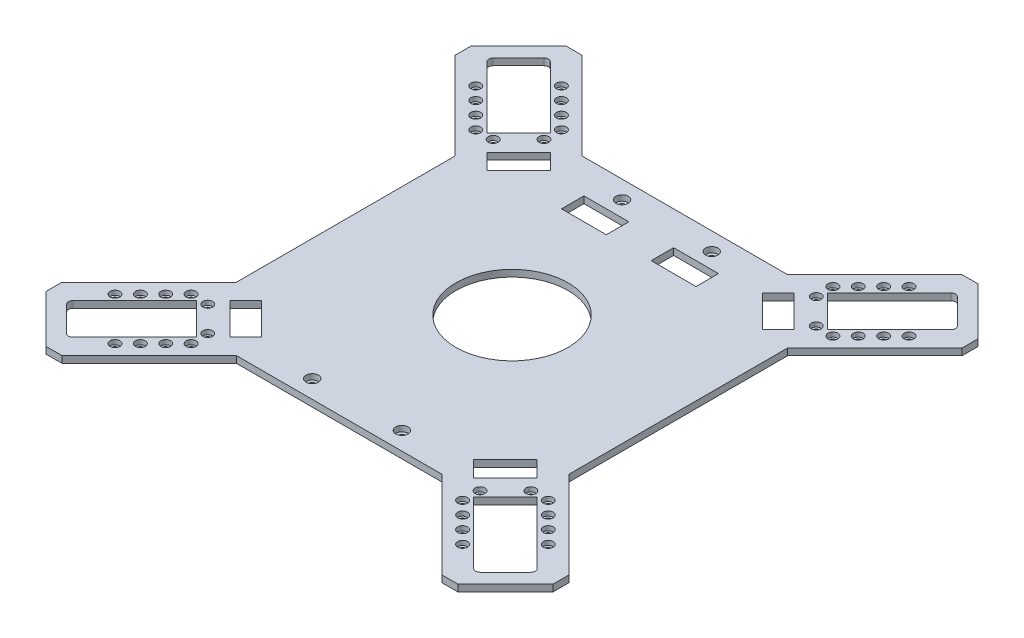
from build123d import *

# Parameters (mm, degrees)
BOSS_EXTRUDE1_DEPTH              = 3
CUT_EXTRUDE1_DEPTH               = 10
CUT_EXTRUDE2_DEPTH               = 10
CBORE_FOR_M2_SHCS1_D             = 2.4
CBORE_FOR_M2_SHCS1_CBORE_D       = 4.4
CBORE_FOR_M2_SHCS1_CBORE_DEPTH   = 2
MIRROR2_COPY_1_D                 = 2.4
MIRROR2_COPY_1_CBORE_D           = 4.4
MIRROR2_COPY_1_CBORE_DEPTH       = 2
SKETCH8_W                        = 20
SKETCH8_H                        = 10
SKETCH8_W_2                      = 60
CUT_EXTRUDE3_DEPTH               = 10
CBORE_FOR_M2_5_SHCS1_D           = 2.9
CBORE_FOR_M2_5_SHCS1_CBORE_D     = 5.5
CBORE_FOR_M2_5_SHCS1_CBORE_DEPTH = 2.5
CORTAR_EXTRUIR1_DEPTH            = 848
CORTAR_EXTRUIR1_DEPTH_BACK       = 962
CROQUIS1_W                       = 356.551899134
CROQUIS1_H                       = 194.800027737
CROQUIS3_W                       = 148.284271248
CROQUIS3_H                       = 70
SALIENTE_EXTRUIR3_DEPTH          = 3
SALIENTE_EXTRUIR4_DEPTH          = 3
CORTAR_EXTRUIR3_DEPTH            = 3
CROQUIS10_R                      = 1.2
CORTAR_EXTRUIR13_DEPTH           = 3
CROQUIS22_R                      = 2.2
CORTAR_EXTRUIR14_DEPTH           = 2
CORTAR_EXTRUIR16_DEPTH           = 243
CORTAR_EXTRUIR16_DEPTH_BACK      = 68
CROQUIS25_R                      = 1.2
CORTAR_EXTRUIR17_DEPTH           = 3
CROQUIS26_R                      = 1.2
CORTAR_EXTRUIR18_DEPTH           = 3
CROQUIS27_R                      = 2.2
CORTAR_EXTRUIR19_DEPTH           = 2
CROQUIS29_R                      = 1.2
CORTAR_EXTRUIR20_DEPTH           = 3
CROQUIS30_R                      = 2.2
CORTAR_EXTRUIR21_DEPTH           = 2
SALIENTE_EXTRUIR5_DEPTH          = 3
CORTAR_EXTRUIR22_DEPTH           = 3
CROQUIS34_R                      = 1.2
CORTAR_EXTRUIR24_DEPTH           = 3
CROQUIS35_R                      = 2.2
CORTAR_EXTRUIR25_DEPTH           = 2
CROQUIS37_R                      = 1.2
CORTAR_EXTRUIR26_DEPTH           = 3
CROQUIS38_R                      = 2.2
CORTAR_EXTRUIR27_DEPTH           = 2
CROQUIS39_R                      = 1.2
CORTAR_EXTRUIR28_DEPTH           = 3
CROQUIS40_R                      = 2.2
CORTAR_EXTRUIR30_DEPTH           = 2
CROQUIS47_R                      = 1.45
CORTAR_EXTRUIR32_DEPTH           = 3
CROQUIS48_R                      = 2.75
CORTAR_EXTRUIR33_DEPTH           = 2.5
RECUBRIR1_DEPTH                  = 3
RECUBRIR3_DEPTH                  = 3
CROQUIS50_R                      = 12
SALIENTE_EXTRUIR6_DEPTH          = 3
RECUBRIR6_DEPTH                  = 3
RECUBRIR7_DEPTH                  = 3
RECUBRIR8_DEPTH                  = 3
RECUBRIR9_DEPTH                  = 3
RECUBRIR10_DEPTH                 = 3
RECUBRIR13_DEPTH                 = 3
CROQUIS52_R                      = 12
SALIENTE_EXTRUIR8_DEPTH          = 3
CORTAR_EXTRUIR35_DEPTH           = 25
CORTAR_EXTRUIR35_DEPTH_BACK      = 16
CORTAR_EXTRUIR36_DEPTH           = 108
CORTAR_EXTRUIR36_DEPTH_BACK      = 71
CORTAR_EXTRUIR37_DEPTH           = 193
CORTAR_EXTRUIR37_DEPTH_BACK      = 197
CORTAR_EXTRUIR38_DEPTH           = 32
CORTAR_EXTRUIR38_DEPTH_BACK      = 197
CROQUIS59_R                      = 33.414518843
SALIENTE_EXTRUIR9_DEPTH          = 3
CROQUIS60_W                      = 132.087062054
CROQUIS60_H                      = 57.576258356
SALIENTE_EXTRUIR11_DEPTH         = 3
CORTAR_EXTRUIR39_DEPTH           = 95
CORTAR_EXTRUIR39_DEPTH_BACK      = 71
CROQUIS61_W                      = 20
CROQUIS61_H                      = 77.071067813
CROQUIS61_H_2                    = 77.071067812
CORTAR_EXTRUIR40_DEPTH           = 91
CORTAR_EXTRUIR40_DEPTH_BACK      = 81
CROQUIS62_R                      = 10
CORTAR_EXTRUIR41_DEPTH           = 86
CORTAR_EXTRUIR41_DEPTH_BACK      = 121
CROQUIS64_W                      = 110.858929566
CROQUIS64_H                      = 102.967276953
SALIENTE_EXTRUIR12_DEPTH         = 3
CORTAR_EXTRUIR42_DEPTH           = 3
CORTAR_EXTRUIR43_DEPTH           = 44
CORTAR_EXTRUIR43_DEPTH_BACK      = 22
CROQUIS67_R                      = 25
CORTAR_EXTRUIR44_DEPTH           = 22


with BuildPart() as part:
    # Sketch1 → Boss-Extrude1 (new body)
    with BuildSketch(Plane(origin=(0, 0, 0), x_dir=(1, 0, 0), z_dir=(0, 1, 0))):
        Polygon((-74.142135624, -30), (-74.142135624, -85.857864376), (-113.033008589, -124.748737342), (-113.033008589, -131.819805153), (-91.819805153, -153.033008589), (-84.748737342, -153.033008589), (-45.857864376, -114.142135624), (45.857864376, -114.142135624), (84.748737342, -153.033008589), (91.819805153, -153.033008589), (113.033008589, -131.819805153), (113.033008589, -124.748737342), (74.142135624, -85.857864376), (74.142135624, -30), (90.606601718, -20), (145.606601718, -20), (150.606601718, -15), (150.606601718, 15), (145.606601718, 20), (90.606601718, 20), (74.142135624, 30), (74.142135624, 85.857864376), (113.033008589, 124.748737342), (113.033008589, 131.819805153), (91.819805153, 153.033008589), (84.748737342, 153.033008589), (45.857864376, 114.142135624), (-45.857864376, 114.142135624), (-84.748737342, 153.033008589), (-91.819805153, 153.033008589), (-113.033008589, 131.819805153), (-113.033008589, 124.748737342), (-74.142135624, 85.857864376), (-74.142135624, 30), (-90.606601718, 20), (-145.606601718, 20), (-150.606601718, 15), (-150.606601718, -15), (-145.606601718, -20), (-90.606601718, -20), align=None)
    extrude(amount=BOSS_EXTRUDE1_DEPTH)

    # Sketch2 → Cut-Extrude1 (cut)
    with BuildSketch(Plane(origin=(0, 3, 0), x_dir=(1, 0, 0), z_dir=(0, 1, 0))):
        with BuildLine():
            Line((103.106601718, 10), (128.973352137, 10))
            ThreePointArc((128.973352137, 10), (147.606601718, 0), (128.973352137, -10))
            Line((128.973352137, -10), (103.106601718, -10))
            Line((103.106601718, -10), (103.106601718, 10))
        make_face()
        with BuildLine():
            Line((-103.106601718, -10), (-128.973352137, -10))
            ThreePointArc((-128.973352137, -10), (-147.606601718, 0), (-128.973352137, 10))
            Line((-128.973352137, 10), (-103.106601718, 10))
            Line((-103.106601718, 10), (-103.106601718, -10))
        make_face()
    extrude(amount=-CUT_EXTRUDE1_DEPTH, mode=Mode.SUBTRACT)

    # Sketch4 → Cut-Extrude2 (cut)
    with BuildSketch(Plane(origin=(0, 3, 0), x_dir=(1, 0, 0), z_dir=(0, 1, 0))):
        with BuildLine():
            Line((-75.909902577, 101.767766953), (-61.767766953, 115.909902577))
            Line((-61.767766953, 115.909902577), (-80.058321582, 134.200457205))
            ThreePointArc((-80.058321582, 134.200457205), (-100.305086528, 140.305086528), (-94.200457205, 120.058321582))
            Line((-94.200457205, 120.058321582), (-75.909902577, 101.767766953))
        make_face()
        with BuildLine():
            Line((94.200457205, 120.058321582), (75.909902577, 101.767766953))
            Line((75.909902577, 101.767766953), (61.767766953, 115.909902577))
            Line((61.767766953, 115.909902577), (80.058321582, 134.200457205))
            ThreePointArc((80.058321582, 134.200457205), (100.305086528, 140.305086528), (94.200457205, 120.058321582))
        make_face()
        with BuildLine():
            Line((75.909902577, -101.767766953), (61.767766953, -115.909902577))
            Line((61.767766953, -115.909902577), (80.058321582, -134.200457205))
            ThreePointArc((80.058321582, -134.200457205), (100.305086528, -140.305086528), (94.200457205, -120.058321582))
            Line((94.200457205, -120.058321582), (75.909902577, -101.767766953))
        make_face()
        with BuildLine():
            Line((-94.200457205, -120.058321582), (-75.909902577, -101.767766953))
            Line((-75.909902577, -101.767766953), (-61.767766953, -115.909902577))
            Line((-61.767766953, -115.909902577), (-80.058321582, -134.200457205))
            ThreePointArc((-80.058321582, -134.200457205), (-100.305086528, -140.305086528), (-94.200457205, -120.058321582))
        make_face()
    extrude(amount=-CUT_EXTRUDE2_DEPTH, mode=Mode.SUBTRACT)

    # CBORE for M2 SHCS1 (through all)
    with Locations(Plane(origin=(0, 3, 0), x_dir=(-1, 0, 0), z_dir=(0, 1, 0))):
        with Locations((-104.856601718, -13.5), (-112.856601718, -13.5), (-120.856601718, -13.5), (-128.856601718, -13.5), (-60.530330086, -119.622213178), (-66.187184335, -125.279067427), (-71.844038585, -130.935921677), (-77.500892834, -136.592775926), (-79.622213178, -100.530330086), (-85.279067427, -106.187184335), (-90.935921677, -111.844038585), (-96.592775926, -117.500892834), (-104.856601718, 13.5), (-112.856601718, 13.5), (-120.856601718, 13.5), (-128.856601718, 13.5), (-60.707106781, -112.02081528), (-72.02081528, -100.707106781), (-99.606601718, -8), (-99.606601718, 8)):
            cbore_for_m2_shcs1 = CounterBoreHole(CBORE_FOR_M2_SHCS1_D / 2, CBORE_FOR_M2_SHCS1_CBORE_D / 2, CBORE_FOR_M2_SHCS1_CBORE_DEPTH)

    # Mirror1: CBORE for M2 SHCS1 across plane
    add(cbore_for_m2_shcs1.mirror(Plane(origin=(0, 0, 0), x_dir=(0, 0, 1), z_dir=(1, 0, 0))), mode=Mode.SUBTRACT)

    # Mirror2: CBORE for M2 SHCS1 across plane
    add(cbore_for_m2_shcs1.mirror(Plane.XY), mode=Mode.SUBTRACT)

    # Mirror2 copy 1 (through all)
    with Locations(Plane(origin=(0, 3, 0), x_dir=(1, 0, 0), z_dir=(0, 1, 0))):
        with Locations((-104.856601718, -13.5), (-112.856601718, -13.5), (-120.856601718, -13.5), (-128.856601718, -13.5), (-60.530330086, -119.622213178), (-66.187184335, -125.279067427), (-71.844038585, -130.935921677), (-77.500892834, -136.592775926), (-79.622213178, -100.530330086), (-85.279067427, -106.187184335), (-90.935921677, -111.844038585), (-96.592775926, -117.500892834), (-104.856601718, 13.5), (-112.856601718, 13.5), (-120.856601718, 13.5), (-128.856601718, 13.5), (-60.707106781, -112.02081528), (-72.02081528, -100.707106781), (-99.606601718, -8), (-99.606601718, 8)):
            CounterBoreHole(MIRROR2_COPY_1_D / 2, MIRROR2_COPY_1_CBORE_D / 2, MIRROR2_COPY_1_CBORE_DEPTH)

    # Sketch8 → Cut-Extrude3 (cut)
    with BuildSketch(Plane(origin=(0, 3, 0), x_dir=(1, 0, 0), z_dir=(0, 1, 0))):
        with Locations((20, -94.142135624)):
            Rectangle(SKETCH8_W, SKETCH8_H)
        with Locations((-20, -94.142135624)):
            Rectangle(SKETCH8_W, SKETCH8_H)
        Polygon((-20, -28.162470747), (-55, -28.162470747), (-60, -33.162470747), (-60, -78.162470747), (-55.430942257, -81.131778417), (-19.569057743, -65.193163077), (-15, -58.162470747), (-15, -33.162470747), align=None)
        with Locations((0, -15)):
            Rectangle(SKETCH8_W_2, SKETCH8_H)
        Polygon((55, -28.162470747), (20, -28.162470747), (15, -33.162470747), (15, -58.162470747), (19.569057743, -65.193163077), (55.430942257, -81.131778417), (60, -78.162470747), (60, -33.162470747), align=None)
        Polygon((-20, 28.162470747), (-55, 28.162470747), (-60, 33.162470747), (-60, 78.162470747), (-55.430942257, 81.131778417), (-19.569057743, 65.193163077), (-15, 58.162470747), (-15, 33.162470747), align=None)
        Polygon((20, 28.162470747), (15, 33.162470747), (15, 58.162470747), (19.569057743, 65.193163077), (55.430942257, 81.131778417), (60, 78.162470747), (60, 33.162470747), (55, 28.162470747), align=None)
        with Locations((20, 94.142135624)):
            Rectangle(SKETCH8_W, SKETCH8_H)
        with Locations((-20, 94.142135624)):
            Rectangle(SKETCH8_W, SKETCH8_H)
    extrude(amount=-CUT_EXTRUDE3_DEPTH, mode=Mode.SUBTRACT)

    # CBORE for M2.5 SHCS1 (through all)
    with Locations(Plane(origin=(0, 3, 0), x_dir=(-1, 0, 0), z_dir=(0, 1, 0))):
        with Locations((20, -106.142135624), (-20, -106.142135624), (20, 106.142135624), (-20, 106.142135624)):
            CounterBoreHole(CBORE_FOR_M2_5_SHCS1_D / 2, CBORE_FOR_M2_5_SHCS1_CBORE_D / 2, CBORE_FOR_M2_5_SHCS1_CBORE_DEPTH)

    # Croquis1 → Cortar-Extruir1 (cut, two sides: drawn at the far end of the back side and taken through both)
    with BuildSketch(Plane(origin=(0, 3, 0), x_dir=(-1, 0, 0), z_dir=(0, 1, 0)).offset(-CORTAR_EXTRUIR1_DEPTH_BACK)):
        with Locations((8.604943845, 67.400013869)):
            Rectangle(CROQUIS1_W, CROQUIS1_H)
    extrude(amount=CORTAR_EXTRUIR1_DEPTH + CORTAR_EXTRUIR1_DEPTH_BACK, mode=Mode.SUBTRACT)

    # Croquis3 → Saliente-Extruir3 (add)
    with BuildSketch(Plane(origin=(0, 3, 0), x_dir=(1, 0, 0), z_dir=(0, 1, 0))):
        with Locations((0, -5)):
            Rectangle(CROQUIS3_W, CROQUIS3_H)
    extrude(amount=-SALIENTE_EXTRUIR3_DEPTH)

    # Croquis7 → Saliente-Extruir4 (add)
    with BuildSketch(Plane(origin=(0, 3, 0), x_dir=(-1, 0, 0), z_dir=(0, 1, 0))):
        Polygon((-113.033008589, 57.677669527), (-102.426406871, 68.284271245), (-91.819805152, 78.890872964), (-84.74873734, 78.890872964), (-45.857864376, 40), (-74.142135624, 11.71572875), (-113.033008589, 50.606601715), align=None)
    extrude(amount=-SALIENTE_EXTRUIR4_DEPTH)

    # Croquis9 → Cortar-Extruir3 (cut)
    with BuildSketch(Plane(origin=(0, 3, 0), x_dir=(-1, 0, 0), z_dir=(0, 1, 0))):
        with BuildLine():
            Line((-61.767766953, 41.767766952), (-75.909902577, 27.625631328))
            Line((-75.909902577, 27.625631328), (-94.200457205, 45.916185957))
            ThreePointArc((-94.200457205, 45.916185957), (-100.305086528, 66.162950903), (-80.058321582, 60.05832158))
            Line((-80.058321582, 60.05832158), (-61.767766953, 41.767766952))
        make_face()
    extrude(amount=-CORTAR_EXTRUIR3_DEPTH, mode=Mode.SUBTRACT)

    # Croquis10 → Cortar-Extruir13 (cut)
    with BuildSketch(Plane(origin=(0, 3, 0), x_dir=(-1, 0, 0), z_dir=(0, 1, 0))):
        with Locations(Location((-79.622213179, 26.388194461, 0), (0, 0, 90))):
            Circle(CROQUIS10_R)
        with Locations(Location((-85.279067429, 32.04504871, 0), (0, 0, 90))):
            Circle(CROQUIS10_R)
        with Locations(Location((-90.935921678, 37.70190296, 0), (0, 0, 90))):
            Circle(CROQUIS10_R)
        with Locations(Location((-96.592775928, 43.358757209, 0), (0, 0, 90))):
            Circle(CROQUIS10_R)
    extrude(amount=-CORTAR_EXTRUIR13_DEPTH, mode=Mode.SUBTRACT)

    # Croquis22 → Cortar-Extruir14 (cut)
    with BuildSketch(Plane(origin=(0, 3, 0), x_dir=(-1, 0, 0), z_dir=(0, 1, 0))):
        with Locations(Location((-79.622213179, 26.388194461, 0), (0, 0, 90))):
            Circle(CROQUIS22_R)
        with Locations(Location((-85.279067429, 32.04504871, 0), (0, 0, 90))):
            Circle(CROQUIS22_R)
        with Locations(Location((-90.935921678, 37.70190296, 0), (0, 0, 90))):
            Circle(CROQUIS22_R)
        with Locations(Location((-96.592775928, 43.358757209, 0), (0, 0, 90))):
            Circle(CROQUIS22_R)
    extrude(amount=-CORTAR_EXTRUIR14_DEPTH, mode=Mode.SUBTRACT)

    # Croquis23 → Cortar-Extruir16 (cut, two sides: drawn at the far end of the back side and taken through both)
    with BuildSketch(Plane(origin=(0, 3, 0), x_dir=(-1, 0, 0), z_dir=(0, 1, 0)).offset(-CORTAR_EXTRUIR16_DEPTH_BACK)):
        with BuildLine():
            Line((6.062177826, -29.914518843), (28.937822174, 9.707259422))
            ThreePointArc((28.937822174, 9.707259422), (28.937822174, 16.707259422), (22.875644347, 20.207259422))
            Line((22.875644347, 20.207259422), (-22.875644347, 20.207259422))
            ThreePointArc((-22.875644347, 20.207259422), (-28.937822174, 16.707259422), (-28.937822174, 9.707259422))
            Line((-28.937822174, 9.707259422), (-6.062177826, -29.914518843))
            ThreePointArc((-6.062177826, -29.914518843), (0, -33.414518843), (6.062177826, -29.914518843))
        make_face()
    extrude(amount=CORTAR_EXTRUIR16_DEPTH + CORTAR_EXTRUIR16_DEPTH_BACK, mode=Mode.SUBTRACT)

    # Croquis25 → Cortar-Extruir17 (cut)
    with BuildSketch(Plane(origin=(0, 3, 0), x_dir=(-1, 0, 0), z_dir=(0, 1, 0))):
        with Locations(Location((-60.530330086, 45.480077554, 0), (0, 0, 90))):
            Circle(CROQUIS25_R)
        with Locations(Location((-66.187184335, 51.136931804, 0), (0, 0, 90))):
            Circle(CROQUIS25_R)
        with Locations(Location((-71.844038585, 56.793786053, 0), (0, 0, 90))):
            Circle(CROQUIS25_R)
    extrude(amount=-CORTAR_EXTRUIR17_DEPTH, mode=Mode.SUBTRACT)

    # Croquis26 → Cortar-Extruir18 (cut)
    with BuildSketch(Plane(origin=(0, 3, 0), x_dir=(-1, 0, 0), z_dir=(0, 1, 0))):
        with Locations(Location((-77.500892834, 62.450640303, 0), (0, 0, 90))):
            Circle(CROQUIS26_R)
    extrude(amount=-CORTAR_EXTRUIR18_DEPTH, mode=Mode.SUBTRACT)

    # Croquis27 → Cortar-Extruir19 (cut)
    with BuildSketch(Plane(origin=(0, 3, 0), x_dir=(-1, 0, 0), z_dir=(0, 1, 0))):
        with Locations(Location((-60.530330086, 45.480077554, 0), (0, 0, 90))):
            Circle(CROQUIS27_R)
        with Locations(Location((-66.187184335, 51.136931804, 0), (0, 0, 90))):
            Circle(CROQUIS27_R)
        with Locations(Location((-71.844038585, 56.793786053, 0), (0, 0, 90))):
            Circle(CROQUIS27_R)
        with Locations(Location((-77.500892834, 62.450640303, 0), (0, 0, 90))):
            Circle(CROQUIS27_R)
    extrude(amount=-CORTAR_EXTRUIR19_DEPTH, mode=Mode.SUBTRACT)

    # Croquis29 → Cortar-Extruir20 (cut)
    with BuildSketch(Plane(origin=(0, 3, 0), x_dir=(-1, 0, 0), z_dir=(0, 1, 0))):
        with Locations(Location((-60.707106781, 37.878679656, 0), (0, 0, 90))):
            Circle(CROQUIS29_R)
        with Locations(Location((-72.02081528, 26.564971155, 0), (0, 0, 90))):
            Circle(CROQUIS29_R)
    extrude(amount=-CORTAR_EXTRUIR20_DEPTH, mode=Mode.SUBTRACT)

    # Croquis30 → Cortar-Extruir21 (cut)
    with BuildSketch(Plane(origin=(0, 3, 0), x_dir=(-1, 0, 0), z_dir=(0, 1, 0))):
        with Locations(Location((-60.707106781, 37.878679656, 0), (0, 0, 90))):
            Circle(CROQUIS30_R)
        with Locations(Location((-72.02081528, 26.564971155, 0), (0, 0, 90))):
            Circle(CROQUIS30_R)
    extrude(amount=-CORTAR_EXTRUIR21_DEPTH, mode=Mode.SUBTRACT)

    # Croquis31 → Saliente-Extruir5 (add)
    with BuildSketch(Plane(origin=(0, 3, 0), x_dir=(-1, 0, 0), z_dir=(0, 1, 0))):
        Polygon((84.748737342, 78.890872965), (45.857864376, 40), (74.142135624, 11.715728753), (113.033008589, 50.606601718), (113.033008589, 57.67766953), (91.819805153, 78.890872965), align=None)
    extrude(amount=-SALIENTE_EXTRUIR5_DEPTH)

    # Croquis33 → Cortar-Extruir22 (cut)
    with BuildSketch(Plane(origin=(0, 3, 0), x_dir=(-1, 0, 0), z_dir=(0, 1, 0))):
        with BuildLine():
            Line((61.767766953, 41.767766953), (75.909902577, 27.625631329))
            Line((75.909902577, 27.625631329), (94.200457205, 45.916185958))
            ThreePointArc((94.200457205, 45.916185958), (100.305086528, 66.162950904), (80.058321582, 60.058321582))
            Line((80.058321582, 60.058321582), (61.767766953, 41.767766953))
        make_face()
    extrude(amount=-CORTAR_EXTRUIR22_DEPTH, mode=Mode.SUBTRACT)

    # Croquis34 → Cortar-Extruir24 (cut)
    with BuildSketch(Plane(origin=(0, 3, 0), x_dir=(-1, 0, 0), z_dir=(0, 1, 0))):
        with Locations(Location((60.530330086, 45.480077554, 0), (0, 0, 90))):
            Circle(CROQUIS34_R)
        with Locations(Location((66.187184335, 51.136931804, 0), (0, 0, 90))):
            Circle(CROQUIS34_R)
        with Locations(Location((71.844038585, 56.793786053, 0), (0, 0, 90))):
            Circle(CROQUIS34_R)
        with Locations(Location((77.500892834, 62.450640303, 0), (0, 0, 90))):
            Circle(CROQUIS34_R)
    extrude(amount=-CORTAR_EXTRUIR24_DEPTH, mode=Mode.SUBTRACT)

    # Croquis35 → Cortar-Extruir25 (cut)
    with BuildSketch(Plane(origin=(0, 3, 0), x_dir=(-1, 0, 0), z_dir=(0, 1, 0))):
        with Locations(Location((60.530330086, 45.480077554, 0), (0, 0, 90))):
            Circle(CROQUIS35_R)
        with Locations(Location((66.187184335, 51.136931804, 0), (0, 0, 90))):
            Circle(CROQUIS35_R)
        with Locations(Location((71.844038585, 56.793786053, 0), (0, 0, 90))):
            Circle(CROQUIS35_R)
        with Locations(Location((77.500892834, 62.450640303, 0), (0, 0, 90))):
            Circle(CROQUIS35_R)
    extrude(amount=-CORTAR_EXTRUIR25_DEPTH, mode=Mode.SUBTRACT)

    # Croquis37 → Cortar-Extruir26 (cut)
    with BuildSketch(Plane(origin=(0, 3, 0), x_dir=(-1, 0, 0), z_dir=(0, 1, 0))):
        with Locations(Location((79.622213178, 26.388194461, 0), (0, 0, 90))):
            Circle(CROQUIS37_R)
        with Locations(Location((85.279067427, 32.04504871, 0), (0, 0, 90))):
            Circle(CROQUIS37_R)
        with Locations(Location((90.935921677, 37.70190296, 0), (0, 0, 90))):
            Circle(CROQUIS37_R)
        with Locations(Location((96.592775926, 43.358757209, 0), (0, 0, 90))):
            Circle(CROQUIS37_R)
    extrude(amount=-CORTAR_EXTRUIR26_DEPTH, mode=Mode.SUBTRACT)

    # Croquis38 → Cortar-Extruir27 (cut)
    with BuildSketch(Plane(origin=(0, 3, 0), x_dir=(-1, 0, 0), z_dir=(0, 1, 0))):
        with Locations(Location((79.622213178, 26.388194461, 0), (0, 0, 90))):
            Circle(CROQUIS38_R)
        with Locations(Location((85.279067427, 32.04504871, 0), (0, 0, 90))):
            Circle(CROQUIS38_R)
        with Locations(Location((90.935921677, 37.70190296, 0), (0, 0, 90))):
            Circle(CROQUIS38_R)
        with Locations(Location((96.592775926, 43.358757209, 0), (0, 0, 90))):
            Circle(CROQUIS38_R)
    extrude(amount=-CORTAR_EXTRUIR27_DEPTH, mode=Mode.SUBTRACT)

    # Croquis39 → Cortar-Extruir28 (cut)
    with BuildSketch(Plane(origin=(0, 3, 0), x_dir=(-1, 0, 0), z_dir=(0, 1, 0))):
        with Locations(Location((72.02081528, 26.564971157, 0), (0, 0, 90))):
            Circle(CROQUIS39_R)
        with Locations(Location((60.707106781, 37.878679656, 0), (0, 0, 90))):
            Circle(CROQUIS39_R)
    extrude(amount=-CORTAR_EXTRUIR28_DEPTH, mode=Mode.SUBTRACT)

    # Croquis40 → Cortar-Extruir30 (cut)
    with BuildSketch(Plane(origin=(0, 3, 0), x_dir=(-1, 0, 0), z_dir=(0, 1, 0))):
        with Locations(Location((72.02081528, 26.564971157, 0), (0, 0, 90))):
            Circle(CROQUIS40_R)
        with Locations(Location((60.707106781, 37.878679656, 0), (0, 0, 90))):
            Circle(CROQUIS40_R)
    extrude(amount=-CORTAR_EXTRUIR30_DEPTH, mode=Mode.SUBTRACT)

    # Croquis47 → Cortar-Extruir32 (cut)
    with BuildSketch(Plane(origin=(0, 3, 0), x_dir=(-1, 0, 0), z_dir=(0, 1, 0))):
        with Locations(Location((20, 32, 0), (0, 0, 90))):
            Circle(CROQUIS47_R)
        with Locations(Location((-20, 32, 0), (0, 0, 90))):
            Circle(CROQUIS47_R)
    extrude(amount=-CORTAR_EXTRUIR32_DEPTH, mode=Mode.SUBTRACT)

    # Croquis48 → Cortar-Extruir33 (cut)
    with BuildSketch(Plane(origin=(0, 3, 0), x_dir=(-1, 0, 0), z_dir=(0, 1, 0))):
        with Locations(Location((20, 32, 0), (0, 0, 90))):
            Circle(CROQUIS48_R)
        with Locations(Location((-20, 32, 0), (0, 0, 90))):
            Circle(CROQUIS48_R)
    extrude(amount=-CORTAR_EXTRUIR33_DEPTH, mode=Mode.SUBTRACT)

    # Recubrir1: read off the stored shape, not the designer's step
    # Recubrir1 outline → Recubrir1 (add)
    with BuildSketch(Plane(origin=(0, 0, 0), x_dir=(1, 0, 0), z_dir=(0, 1, 0))):
        Polygon((-75.909902577, 101.767766953), (-61.767766953, 115.909902577), (-94.200457205, 120.058321582), align=None)
    extrude(amount=RECUBRIR1_DEPTH)

    # Recubrir3: read off the stored shape, not the designer's step
    # Recubrir3 outline → Recubrir3 (add)
    with BuildSketch(Plane(origin=(0, 0, 0), x_dir=(1, 0, 0), z_dir=(0, 1, 0))):
        Polygon((-80.058321582, 134.200457205), (-94.200457205, 120.058321582), (-61.767766953, 115.909902577), align=None)
    extrude(amount=RECUBRIR3_DEPTH)

    # Croquis50 → Saliente-Extruir6 (add)
    with BuildSketch(Plane(origin=(0, 3, 0), x_dir=(-1, 0, 0), z_dir=(0, 1, 0))):
        with Locations((91.819805153, -131.819805153)):
            Circle(CROQUIS50_R)
    extrude(amount=-SALIENTE_EXTRUIR6_DEPTH)

    # Recubrir6: read off the stored shape, not the designer's step
    # Recubrir6 outline → Recubrir6 (add)
    with BuildSketch(Plane(origin=(0, 0, 0), x_dir=(1, 0, 0), z_dir=(0, 1, 0))):
        Polygon((94.200457205, 120.058321582), (61.767766953, 115.909902577), (75.909902577, 101.767766953), align=None)
    extrude(amount=RECUBRIR6_DEPTH)

    # Recubrir7: read off the stored shape, not the designer's step
    # Recubrir7 outline → Recubrir7 (add)
    with BuildSketch(Plane(origin=(0, 0, 0), x_dir=(1, 0, 0), z_dir=(0, 1, 0))):
        Polygon((61.767766953, 115.909902577), (94.200457205, 120.058321582), (80.058321582, 134.200457205), align=None)
    extrude(amount=RECUBRIR7_DEPTH)

    # Recubrir8: read off the stored shape, not the designer's step
    # Recubrir8 outline → Recubrir8 (add)
    with BuildSketch(Plane(origin=(0, 0, 0), x_dir=(1, 0, 0), z_dir=(0, 1, 0))):
        Polygon((75.909902577, -27.625631328), (61.767766953, -41.767766952), (94.200457205, -45.916185957), align=None)
    extrude(amount=RECUBRIR8_DEPTH)

    # Recubrir9: read off the stored shape, not the designer's step
    # Recubrir9 outline → Recubrir9 (add)
    with BuildSketch(Plane(origin=(0, 0, 0), x_dir=(1, 0, 0), z_dir=(0, 1, 0))):
        Polygon((61.767766953, -41.767766952), (80.058321582, -60.05832158), (94.200457205, -45.916185957), align=None)
    extrude(amount=RECUBRIR9_DEPTH)

    # Recubrir10: read off the stored shape, not the designer's step
    # Recubrir10 outline → Recubrir10 (add)
    with BuildSketch(Plane(origin=(0, 0, 0), x_dir=(1, 0, 0), z_dir=(0, 1, 0))):
        Polygon((-75.909902577, -27.625631329), (-94.200457205, -45.916185958), (-61.767766953, -41.767766953), align=None)
    extrude(amount=RECUBRIR10_DEPTH)

    # Recubrir13: read off the stored shape, not the designer's step
    # Recubrir13 outline → Recubrir13 (add)
    with BuildSketch(Plane(origin=(0, 0, 0), x_dir=(1, 0, 0), z_dir=(0, 1, 0))):
        with BuildLine():
            Line((-61.767766953, -41.767766953), (-94.200457205, -45.916185958))
            ThreePointArc((-94.200457205, -45.916185958), (-100.305086528, -66.162950904), (-80.058321582, -60.058321582))
            Line((-80.058321582, -60.058321582), (-61.767766953, -41.767766953))
        make_face()
    extrude(amount=RECUBRIR13_DEPTH)

    # Croquis52 → Saliente-Extruir8 (add)
    with BuildSketch(Plane(origin=(0, 3, 0), x_dir=(-1, 0, 0), z_dir=(0, 1, 0))):
        with Locations((-91.819805153, -131.819805153)):
            Circle(CROQUIS52_R)
        with Locations((-91.819805153, 57.677669528)):
            Circle(CROQUIS52_R)
    extrude(amount=-SALIENTE_EXTRUIR8_DEPTH)

    # Croquis53 → Cortar-Extruir35 (cut, two sides: drawn at the far end of the back side and taken through both)
    with BuildSketch(Plane(origin=(0, 3, 0), x_dir=(-1, 0, 0), z_dir=(0, 1, 0)).offset(-CORTAR_EXTRUIR35_DEPTH_BACK)):
        with BuildLine():
            ThreePointArc((103.487067043, -129.344931419), (104.072853481, -130.759144982), (103.487067043, -132.173358544))
            Line((103.487067043, -132.173358544), (92.173358544, -143.487067043))
            ThreePointArc((92.173358544, -143.487067043), (90.759144982, -144.072853481), (89.344931419, -143.487067043))
            Line((89.344931419, -143.487067043), (61.767766953, -115.909902577))
            Line((61.767766953, -115.909902577), (75.909902577, -101.767766953))
            Line((75.909902577, -101.767766953), (103.487067043, -129.344931419))
        make_face()
    extrude(amount=CORTAR_EXTRUIR35_DEPTH + CORTAR_EXTRUIR35_DEPTH_BACK, mode=Mode.SUBTRACT)

    # Croquis54 → Cortar-Extruir36 (cut, two sides: drawn at the far end of the back side and taken through both)
    with BuildSketch(Plane(origin=(0, 3, 0), x_dir=(-1, 0, 0), z_dir=(0, 1, 0)).offset(-CORTAR_EXTRUIR36_DEPTH_BACK)):
        with BuildLine():
            Line((-61.767766953, -115.909902577), (-89.344931419, -143.487067043))
            ThreePointArc((-89.344931419, -143.487067043), (-90.759144982, -144.072853481), (-92.173358544, -143.487067043))
            Line((-92.173358544, -143.487067043), (-103.489782659, -132.170642928))
            ThreePointArc((-103.489782659, -132.170642928), (-104.075569095, -130.756330892), (-103.48964339, -129.342076547))
            Line((-103.48964339, -129.342076547), (-75.909902577, -101.767766953))
            Line((-75.909902577, -101.767766953), (-61.767766953, -115.909902577))
        make_face()
    extrude(amount=CORTAR_EXTRUIR36_DEPTH + CORTAR_EXTRUIR36_DEPTH_BACK, mode=Mode.SUBTRACT)

    # Croquis55 → Cortar-Extruir37 (cut, two sides: drawn at the far end of the back side and taken through both)
    with BuildSketch(Plane(origin=(0, 3, 0), x_dir=(-1, 0, 0), z_dir=(0, 1, 0)).offset(-CORTAR_EXTRUIR37_DEPTH_BACK)):
        with BuildLine():
            Line((75.909902577, 27.625631329), (61.767766953, 41.767766953))
            Line((61.767766953, 41.767766953), (89.344931419, 69.344931419))
            ThreePointArc((89.344931419, 69.344931419), (90.759144982, 69.930717857), (92.173358544, 69.344931419))
            Line((92.173358544, 69.344931419), (103.487067043, 58.03122292))
            ThreePointArc((103.487067043, 58.03122292), (104.072853481, 56.617009358), (103.487067043, 55.202795796))
            Line((103.487067043, 55.202795796), (75.909902577, 27.625631329))
        make_face()
    extrude(amount=CORTAR_EXTRUIR37_DEPTH + CORTAR_EXTRUIR37_DEPTH_BACK, mode=Mode.SUBTRACT)

    # Croquis57 → Cortar-Extruir38 (cut, two sides: drawn at the far end of the back side and taken through both)
    with BuildSketch(Plane(origin=(0, 3, 0), x_dir=(-1, 0, 0), z_dir=(0, 1, 0)).offset(-CORTAR_EXTRUIR38_DEPTH_BACK)):
        with BuildLine():
            Line((-75.909902574, 27.625631324), (-61.767766957, 41.767766954))
            Line((-61.767766957, 41.767766954), (-89.344931421, 69.344931416))
            ThreePointArc((-89.344931421, 69.344931416), (-90.759144983, 69.930717854), (-92.173358545, 69.344931416))
            Line((-92.173358545, 69.344931416), (-103.487067044, 58.031222916))
            ThreePointArc((-103.487067044, 58.031222916), (-104.072853481, 56.617009354), (-103.487067044, 55.202795792))
            Line((-103.487067044, 55.202795792), (-75.909902574, 27.625631324))
        make_face()
    extrude(amount=CORTAR_EXTRUIR38_DEPTH + CORTAR_EXTRUIR38_DEPTH_BACK, mode=Mode.SUBTRACT)

    # Croquis59 → Saliente-Extruir9 (add)
    with BuildSketch(Plane(origin=(0, 3, 0), x_dir=(-1, 0, 0), z_dir=(0, 1, 0))):
        Circle(CROQUIS59_R)
    extrude(amount=-SALIENTE_EXTRUIR9_DEPTH)

    # Croquis60 → Saliente-Extruir11 (add)
    with BuildSketch(Plane(origin=(0, 3, 0), x_dir=(-1, 0, 0), z_dir=(0, 1, 0))):
        with Locations((-0.470144473, -54.676193791)):
            Rectangle(CROQUIS60_W, CROQUIS60_H)
    extrude(amount=-SALIENTE_EXTRUIR11_DEPTH)

    # Croquis61 → Cortar-Extruir39 (cut, two sides: drawn at the far end of the back side and taken through both)
    with BuildSketch(Plane(origin=(0, 3, 0), x_dir=(-1, 0, 0), z_dir=(0, 1, 0)).offset(-CORTAR_EXTRUIR39_DEPTH_BACK)):
        with Locations((37.708675404, -37.071067812)):
            Rectangle(CROQUIS61_W, CROQUIS61_H)
        with Locations((-37.071067812, -37.071067812)):
            Rectangle(CROQUIS61_W, CROQUIS61_H_2)
    extrude(amount=CORTAR_EXTRUIR39_DEPTH + CORTAR_EXTRUIR39_DEPTH_BACK, mode=Mode.SUBTRACT)

    # Croquis62 → Cortar-Extruir40 (cut, two sides: drawn at the far end of the back side and taken through both)
    with BuildSketch(Plane(origin=(0, 3, 0), x_dir=(-1, 0, 0), z_dir=(0, 1, 0)).offset(-CORTAR_EXTRUIR40_DEPTH_BACK)):
        with Locations((37.708675404, -75.606601718)):
            Circle(CROQUIS62_R)
        with Locations((-37.071067812, -75.606601718)):
            Circle(CROQUIS62_R)
        with Locations((-37.071067812, 1.464466094)):
            Circle(CROQUIS62_R)
        with Locations((37.708675404, 1.464466095)):
            Circle(CROQUIS62_R)
    extrude(amount=CORTAR_EXTRUIR40_DEPTH + CORTAR_EXTRUIR40_DEPTH_BACK, mode=Mode.SUBTRACT)

    # Croquis63 → Cortar-Extruir41 (cut, two sides: drawn at the far end of the back side and taken through both)
    with BuildSketch(Plane(origin=(0, 3, 0), x_dir=(-1, 0, 0), z_dir=(0, 1, 0)).offset(-CORTAR_EXTRUIR41_DEPTH_BACK)):
        with BuildLine():
            Line((1.732050808, -12), (11.258330249, 4.5))
            ThreePointArc((11.258330249, 4.5), (11.258330249, 6.5), (9.526279442, 7.5))
            Line((9.526279442, 7.5), (-9.526279442, 7.5))
            ThreePointArc((-9.526279442, 7.5), (-11.258330249, 6.5), (-11.258330249, 4.5))
            Line((-11.258330249, 4.5), (-1.732050808, -12))
            ThreePointArc((-1.732050808, -12), (0, -13), (1.732050808, -12))
        make_face()
        with BuildLine():
            Line((-1.732050808, -48), (-11.258330249, -64.5))
            ThreePointArc((-11.258330249, -64.5), (-11.258330249, -66.5), (-9.526279442, -67.5))
            Line((-9.526279442, -67.5), (9.526279442, -67.5))
            ThreePointArc((9.526279442, -67.5), (11.258330249, -66.5), (11.258330249, -64.5))
            Line((11.258330249, -64.5), (1.732050808, -48))
            ThreePointArc((1.732050808, -48), (0, -47), (-1.732050808, -48))
        make_face()
    extrude(amount=CORTAR_EXTRUIR41_DEPTH + CORTAR_EXTRUIR41_DEPTH_BACK, mode=Mode.SUBTRACT)

    # Croquis64 → Saliente-Extruir12 (add)
    with BuildSketch(Plane(origin=(0, 3, 0), x_dir=(-1, 0, 0), z_dir=(0, 1, 0))):
        with Locations((2.146003889, -35.90164279)):
            Rectangle(CROQUIS64_W, CROQUIS64_H)
    extrude(amount=-SALIENTE_EXTRUIR12_DEPTH)

    # Croquis65 → Cortar-Extruir42 (cut)
    with BuildSketch(Plane(origin=(0, 3, 0), x_dir=(-1, 0, 0), z_dir=(0, 1, 0))):
        Polygon((61.414213562, 13.129942315), (47.272077939, 27.272077939), (54.343145751, 34.343145751), (68.485281374, 20.201010127), align=None)
    extrude(amount=-CORTAR_EXTRUIR42_DEPTH, mode=Mode.SUBTRACT)

    # Croquis66 → Cortar-Extruir43 (cut, two sides: drawn at the far end of the back side and taken through both)
    with BuildSketch(Plane(origin=(0, 3, 0), x_dir=(-1, 0, 0), z_dir=(0, 1, 0)).offset(-CORTAR_EXTRUIR43_DEPTH_BACK)):
        Polygon((-47.272077939, -101.414213562), (-61.414213562, -87.272077939), (-68.485281374, -94.34314575), (-54.34314575, -108.485281374), align=None)
        Polygon((-61.414213562, 13.129942313), (-47.272077938, 27.272077937), (-54.34314575, 34.343145748), (-68.485281373, 20.201010125), align=None)
        Polygon((47.272077939, -101.414213562), (61.414213562, -87.272077939), (68.485281374, -94.343145751), (54.343145751, -108.485281374), align=None)
    extrude(amount=CORTAR_EXTRUIR43_DEPTH + CORTAR_EXTRUIR43_DEPTH_BACK, mode=Mode.SUBTRACT)

    # Croquis67 → Cortar-Extruir44 (cut)
    with BuildSketch(Plane(origin=(0, 3, 0), x_dir=(-1, 0, 0), z_dir=(0, 1, 0))):
        with Locations(Location((0, -37.071067812, 0), (0, 0, 90))):
            Circle(CROQUIS67_R)
    extrude(amount=-CORTAR_EXTRUIR44_DEPTH, mode=Mode.SUBTRACT)


solid = part.part
